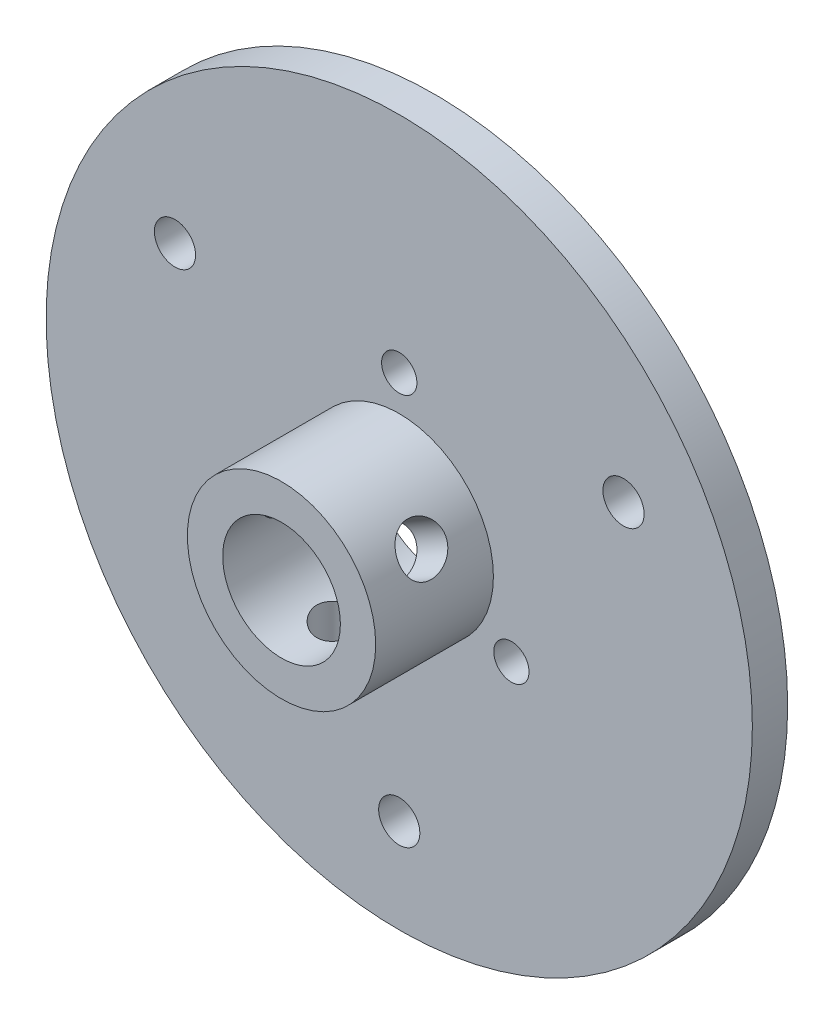
from build123d import *

# Parameters (mm, degrees)
SKETCH2_R           = 30
SKETCH2_R_2         = 5
SKETCH2_R_3         = 1.75
BOSS_EXTRUDE1_DEPTH = 3
SKETCH3_R           = 8
SKETCH3_R_2         = 5
BOSS_EXTRUDE2_DEPTH = 10
SKETCH4_R           = 1.5
CUT_EXTRUDE2_DEPTH  = 44.588989435
SKETCH12_R          = 2
CUT_EXTRUDE3_DEPTH  = 11.49377522
CIRPATTERN1_COUNT   = 3


with BuildPart() as part:
    # Sketch2 → Boss-Extrude1 (new body)
    with BuildSketch(Plane.XY):
        Circle(SKETCH2_R)
        Circle(SKETCH2_R_2, mode=Mode.SUBTRACT)
        with Locations((0, -22)):
            Circle(SKETCH2_R_3, mode=Mode.SUBTRACT)
        with Locations((-19.052558883, 11)):
            Circle(SKETCH2_R_3, mode=Mode.SUBTRACT)
        with Locations((19.052558883, 11)):
            Circle(SKETCH2_R_3, mode=Mode.SUBTRACT)
    extrude(amount=BOSS_EXTRUDE1_DEPTH)

    # Sketch3 → Boss-Extrude2 (add)
    with BuildSketch(Plane.XY.offset(3)):
        Circle(SKETCH3_R)
        Circle(SKETCH3_R_2, mode=Mode.SUBTRACT)
    extrude(amount=BOSS_EXTRUDE2_DEPTH)

    # Sketch4 → Cut-Extrude2 (cut, through all)
    with BuildSketch(Plane.XY.offset(3)):
        with Locations((0, 11)):
            Circle(SKETCH4_R)
        with Locations((9.526279442, -5.5)):
            Circle(SKETCH4_R)
        with Locations((-9.526279442, -5.5)):
            Circle(SKETCH4_R)
    extrude(amount=-CUT_EXTRUDE2_DEPTH, mode=Mode.SUBTRACT)

    # Sketch12 → Cut-Extrude3 (cut)
    with BuildSketch(Plane(origin=(0, 0, 0), x_dir=(1, 0, 0), z_dir=(0, 1, 0))):
        with Locations((0, -8)):
            Circle(SKETCH12_R)
    cut_extrude3 = extrude(amount=-CUT_EXTRUDE3_DEPTH, mode=Mode.SUBTRACT)

    # CirPattern1: Cut-Extrude3 ×3 about axis
    cirpattern1_axis = Axis((0, 0, 13), (0, 0, 1))
    for i in range(1, CIRPATTERN1_COUNT):
        add(cut_extrude3.rotate(cirpattern1_axis, i * 360 / CIRPATTERN1_COUNT), mode=Mode.SUBTRACT)


solid = part.part
